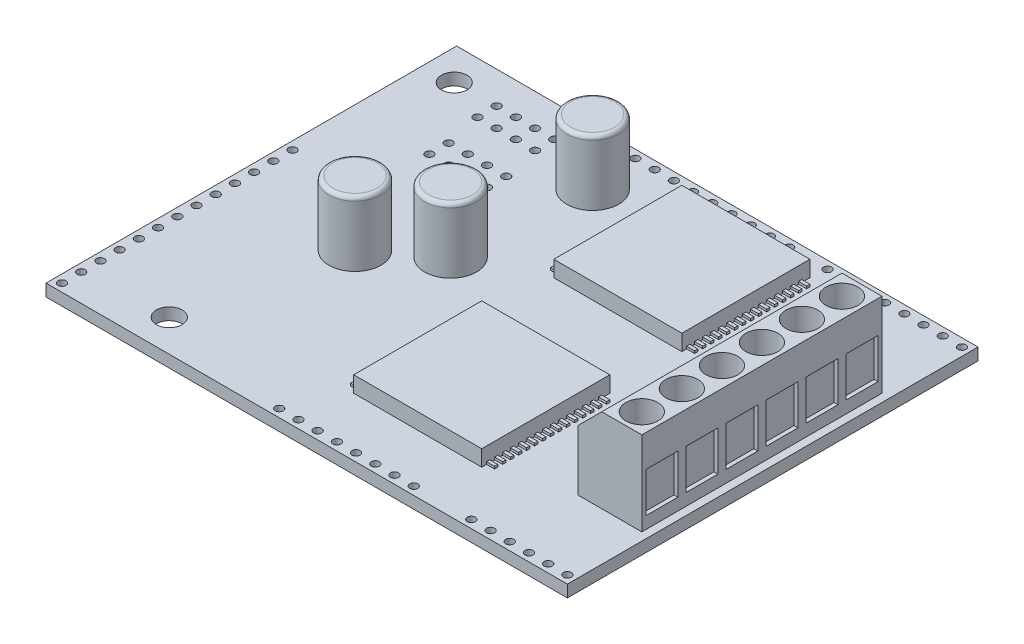
from build123d import *

# Parameters (mm, degrees)
SKETCH_1_W          = 65.14
SKETCH_1_H          = 51.3
EXTRUDE_1_DEPTH     = 1.5
SKETCH_2_W          = 16
SKETCH_2_H          = 16
EXTRUDE_2_DEPTH     = 2
SKETCH_3_W          = 1
SKETCH_3_H          = 0.4
EXTRUDE_3_DEPTH     = 0.3
SKETCH_4_R          = 0.5
SKETCH_4_R_2        = 1.6
CUT_EXTRUDE_1_DEPTH = 2
SKETCH_5_W          = 8
SKETCH_5_H          = 30
EXTRUDE_4_DEPTH     = 10.5
CHAMFER_1_SIZE      = 3
SKETCH_6_R          = 2
CUT_EXTRUDE_2_DEPTH = 4
SKETCH_7_W          = 4
SKETCH_7_H          = 5
CUT_EXTRUDE_3_DEPTH = 0.5
SKETCH_8_R          = 0.5
CUT_EXTRUDE_4_DEPTH = 0.2
SKETCH_9_R          = 3.25
EXTRUDE_5_DEPTH     = 8.1
FILLET_1_R          = 0.5


with BuildPart() as part:
    # Эскиз1 → Бобышка-Вытянуть1 (new body)
    with BuildSketch(Plane(origin=(0, 0, 0), x_dir=(1, 0, 0), z_dir=(0, 1, 0))):
        Rectangle(SKETCH_1_W, SKETCH_1_H)
    extrude(amount=EXTRUDE_1_DEPTH)

    # Эскиз2 → Бобышка-Вытянуть2 (add)
    with BuildSketch(Plane(origin=(0, 1.5, 0), x_dir=(1, 0, 0), z_dir=(0, 1, 0))):
        with Locations((6.57, 14.65)):
            Rectangle(SKETCH_2_W, SKETCH_2_H)
        with Locations((6.57, -10.35)):
            Rectangle(SKETCH_2_W, SKETCH_2_H)
    extrude(amount=EXTRUDE_2_DEPTH)

    # Эскиз3 → Бобышка-Вытянуть3 (add)
    with BuildSketch(Plane(origin=(0, 1.5, 0), x_dir=(1, 0, 0), z_dir=(0, 1, 0))):
        with Locations((15.07, 21.45)):
            Rectangle(SKETCH_3_W, SKETCH_3_H)
        with Locations((15.07, 20.45)):
            Rectangle(SKETCH_3_W, SKETCH_3_H)
        with Locations((15.07, 19.45)):
            Rectangle(SKETCH_3_W, SKETCH_3_H)
        with Locations((15.07, 18.45)):
            Rectangle(SKETCH_3_W, SKETCH_3_H)
        with Locations((15.07, 17.45)):
            Rectangle(SKETCH_3_W, SKETCH_3_H)
        with Locations((15.07, 16.45)):
            Rectangle(SKETCH_3_W, SKETCH_3_H)
        with Locations((15.07, 15.45)):
            Rectangle(SKETCH_3_W, SKETCH_3_H)
        with Locations((15.07, 14.45)):
            Rectangle(SKETCH_3_W, SKETCH_3_H)
        with Locations((15.07, 13.45)):
            Rectangle(SKETCH_3_W, SKETCH_3_H)
        with Locations((15.07, 12.45)):
            Rectangle(SKETCH_3_W, SKETCH_3_H)
        with Locations((15.07, 11.45)):
            Rectangle(SKETCH_3_W, SKETCH_3_H)
        with Locations((15.07, 10.45)):
            Rectangle(SKETCH_3_W, SKETCH_3_H)
        with Locations((15.07, 9.45)):
            Rectangle(SKETCH_3_W, SKETCH_3_H)
        with Locations((15.07, 8.45)):
            Rectangle(SKETCH_3_W, SKETCH_3_H)
        with Locations((15.07, 7.45)):
            Rectangle(SKETCH_3_W, SKETCH_3_H)
        with Locations((-1.93, 7.45)):
            Rectangle(SKETCH_3_W, SKETCH_3_H)
        with Locations((-1.93, 8.45)):
            Rectangle(SKETCH_3_W, SKETCH_3_H)
        with Locations((-1.93, 9.45)):
            Rectangle(SKETCH_3_W, SKETCH_3_H)
        with Locations((-1.93, 10.45)):
            Rectangle(SKETCH_3_W, SKETCH_3_H)
        with Locations((-1.93, 11.45)):
            Rectangle(SKETCH_3_W, SKETCH_3_H)
        with Locations((-1.93, 12.45)):
            Rectangle(SKETCH_3_W, SKETCH_3_H)
        with Locations((-1.93, 13.45)):
            Rectangle(SKETCH_3_W, SKETCH_3_H)
        with Locations((-1.93, 14.45)):
            Rectangle(SKETCH_3_W, SKETCH_3_H)
        with Locations((-1.93, 15.45)):
            Rectangle(SKETCH_3_W, SKETCH_3_H)
        with Locations((-1.93, 16.45)):
            Rectangle(SKETCH_3_W, SKETCH_3_H)
        with Locations((-1.93, 17.45)):
            Rectangle(SKETCH_3_W, SKETCH_3_H)
        with Locations((-1.93, 18.45)):
            Rectangle(SKETCH_3_W, SKETCH_3_H)
        with Locations((-1.93, 19.45)):
            Rectangle(SKETCH_3_W, SKETCH_3_H)
        with Locations((-1.93, 20.45)):
            Rectangle(SKETCH_3_W, SKETCH_3_H)
        with Locations((-1.93, 21.45)):
            Rectangle(SKETCH_3_W, SKETCH_3_H)
        with Locations((15.07, -3.55)):
            Rectangle(SKETCH_3_W, SKETCH_3_H)
        with Locations((15.07, -4.55)):
            Rectangle(SKETCH_3_W, SKETCH_3_H)
        with Locations((15.07, -5.55)):
            Rectangle(SKETCH_3_W, SKETCH_3_H)
        with Locations((15.07, -6.55)):
            Rectangle(SKETCH_3_W, SKETCH_3_H)
        with Locations((15.07, -7.55)):
            Rectangle(SKETCH_3_W, SKETCH_3_H)
        with Locations((15.07, -8.55)):
            Rectangle(SKETCH_3_W, SKETCH_3_H)
        with Locations((15.07, -9.55)):
            Rectangle(SKETCH_3_W, SKETCH_3_H)
        with Locations((15.07, -10.55)):
            Rectangle(SKETCH_3_W, SKETCH_3_H)
        with Locations((15.07, -11.55)):
            Rectangle(SKETCH_3_W, SKETCH_3_H)
        with Locations((15.07, -12.55)):
            Rectangle(SKETCH_3_W, SKETCH_3_H)
        with Locations((15.07, -13.55)):
            Rectangle(SKETCH_3_W, SKETCH_3_H)
        with Locations((15.07, -14.55)):
            Rectangle(SKETCH_3_W, SKETCH_3_H)
        with Locations((15.07, -15.55)):
            Rectangle(SKETCH_3_W, SKETCH_3_H)
        with Locations((15.07, -16.55)):
            Rectangle(SKETCH_3_W, SKETCH_3_H)
        with Locations((15.07, -17.55)):
            Rectangle(SKETCH_3_W, SKETCH_3_H)
        with Locations((-1.93, -17.55)):
            Rectangle(SKETCH_3_W, SKETCH_3_H)
        with Locations((-1.93, -16.55)):
            Rectangle(SKETCH_3_W, SKETCH_3_H)
        with Locations((-1.93, -15.55)):
            Rectangle(SKETCH_3_W, SKETCH_3_H)
        with Locations((-1.93, -14.55)):
            Rectangle(SKETCH_3_W, SKETCH_3_H)
        with Locations((-1.93, -13.55)):
            Rectangle(SKETCH_3_W, SKETCH_3_H)
        with Locations((-1.93, -12.55)):
            Rectangle(SKETCH_3_W, SKETCH_3_H)
        with Locations((-1.93, -11.55)):
            Rectangle(SKETCH_3_W, SKETCH_3_H)
        with Locations((-1.93, -10.55)):
            Rectangle(SKETCH_3_W, SKETCH_3_H)
        with Locations((-1.93, -9.55)):
            Rectangle(SKETCH_3_W, SKETCH_3_H)
        with Locations((-1.93, -8.55)):
            Rectangle(SKETCH_3_W, SKETCH_3_H)
        with Locations((-1.93, -7.55)):
            Rectangle(SKETCH_3_W, SKETCH_3_H)
        with Locations((-1.93, -6.55)):
            Rectangle(SKETCH_3_W, SKETCH_3_H)
        with Locations((-1.93, -5.55)):
            Rectangle(SKETCH_3_W, SKETCH_3_H)
        with Locations((-1.93, -4.55)):
            Rectangle(SKETCH_3_W, SKETCH_3_H)
        with Locations((-1.93, -3.55)):
            Rectangle(SKETCH_3_W, SKETCH_3_H)
    extrude(amount=EXTRUDE_3_DEPTH)

    # Эскиз4 → Вырез-Вытянуть1 (cut)
    with BuildSketch(Plane(origin=(0, 1.5, 0), x_dir=(1, 0, 0), z_dir=(0, 1, 0))):
        with Locations((31.57, -24.65)):
            Circle(SKETCH_4_R)
        with Locations((29.17, -24.65)):
            Circle(SKETCH_4_R)
        with Locations((26.77, -24.65)):
            Circle(SKETCH_4_R)
        with Locations((24.37, -24.65)):
            Circle(SKETCH_4_R)
        with Locations((21.97, -24.65)):
            Circle(SKETCH_4_R)
        with Locations((19.57, -24.65)):
            Circle(SKETCH_4_R)
        with Locations((31.57, 24.65)):
            Circle(SKETCH_4_R)
        with Locations((29.17, 24.65)):
            Circle(SKETCH_4_R)
        with Locations((12.37, -24.65)):
            Circle(SKETCH_4_R)
        with Locations((9.97, -24.65)):
            Circle(SKETCH_4_R)
        with Locations((7.57, -24.65)):
            Circle(SKETCH_4_R)
        with Locations((5.17, -24.65)):
            Circle(SKETCH_4_R)
        with Locations((2.77, -24.65)):
            Circle(SKETCH_4_R)
        with Locations((0.37, -24.65)):
            Circle(SKETCH_4_R)
        with Locations((-2.03, -24.65)):
            Circle(SKETCH_4_R)
        with Locations((-4.43, -24.65)):
            Circle(SKETCH_4_R)
        with Locations((26.77, 24.65)):
            Circle(SKETCH_4_R)
        with Locations((24.37, 24.65)):
            Circle(SKETCH_4_R)
        with Locations((21.97, 24.65)):
            Circle(SKETCH_4_R)
        with Locations((19.57, 24.65)):
            Circle(SKETCH_4_R)
        with Locations((17.17, 24.65)):
            Circle(SKETCH_4_R)
        with Locations((14.77, 24.65)):
            Circle(SKETCH_4_R)
        with Locations((-31.57, -24.65)):
            Circle(SKETCH_4_R)
        with Locations((9.97, 24.65)):
            Circle(SKETCH_4_R)
        with Locations((7.57, 24.65)):
            Circle(SKETCH_4_R)
        with Locations((5.17, 24.65)):
            Circle(SKETCH_4_R)
        with Locations((2.77, 24.65)):
            Circle(SKETCH_4_R)
        with Locations((0.37, 24.65)):
            Circle(SKETCH_4_R)
        with Locations((-2.03, 24.65)):
            Circle(SKETCH_4_R)
        with Locations((-4.43, 24.65)):
            Circle(SKETCH_4_R)
        with Locations((-6.83, 24.65)):
            Circle(SKETCH_4_R)
        with Locations((-9.23, 24.65)):
            Circle(SKETCH_4_R)
        with Locations((-11.63, 24.65)):
            Circle(SKETCH_4_R)
        with Locations((-31.57, -22.25)):
            Circle(SKETCH_4_R)
        with Locations((-31.57, -19.85)):
            Circle(SKETCH_4_R)
        with Locations((-31.57, -17.45)):
            Circle(SKETCH_4_R)
        with Locations((-31.57, -15.05)):
            Circle(SKETCH_4_R)
        with Locations((-31.57, -12.65)):
            Circle(SKETCH_4_R)
        with Locations((-31.57, -10.25)):
            Circle(SKETCH_4_R)
        with Locations((-31.57, -7.85)):
            Circle(SKETCH_4_R)
        with Locations((-31.57, -5.45)):
            Circle(SKETCH_4_R)
        with Locations((-31.57, -3.05)):
            Circle(SKETCH_4_R)
        with Locations((-31.57, -0.65)):
            Circle(SKETCH_4_R)
        with Locations((-31.57, 1.75)):
            Circle(SKETCH_4_R)
        with Locations((-31.57, 4.15)):
            Circle(SKETCH_4_R)
        with Locations((-28.77, 21.55)):
            Circle(SKETCH_4_R_2)
        with Locations((-21.17, -21.65)):
            Circle(SKETCH_4_R_2)
        with Locations((-23.57, 21.65)):
            Circle(SKETCH_4_R)
        with Locations((-21.17, 21.65)):
            Circle(SKETCH_4_R)
        with Locations((-18.77, 21.65)):
            Circle(SKETCH_4_R)
        with Locations((-16.37, 21.65)):
            Circle(SKETCH_4_R)
        with Locations((-21.17, 19.25)):
            Circle(SKETCH_4_R)
        with Locations((-18.77, 19.25)):
            Circle(SKETCH_4_R)
        with Locations((-16.37, 19.25)):
            Circle(SKETCH_4_R)
        with Locations((-23.57, 19.25)):
            Circle(SKETCH_4_R)
        with Locations((-22.57, 14.65)):
            Circle(SKETCH_4_R)
        with Locations((-20.17, 14.65)):
            Circle(SKETCH_4_R)
        with Locations((-17.77, 14.65)):
            Circle(SKETCH_4_R)
        with Locations((-15.37, 14.65)):
            Circle(SKETCH_4_R)
        with Locations((-20.17, 12.25)):
            Circle(SKETCH_4_R)
        with Locations((-17.77, 12.25)):
            Circle(SKETCH_4_R)
        with Locations((-15.37, 12.25)):
            Circle(SKETCH_4_R)
        with Locations((-22.57, 12.25)):
            Circle(SKETCH_4_R)
    extrude(amount=-CUT_EXTRUDE_1_DEPTH, mode=Mode.SUBTRACT)

    # Эскиз5 → Бобышка-Вытянуть4 (add)
    with BuildSketch(Plane(origin=(0, 1.5, 0), x_dir=(1, 0, 0), z_dir=(0, 1, 0))):
        with Locations((27.57, -0.35)):
            Rectangle(SKETCH_5_W, SKETCH_5_H)
    extrude(amount=EXTRUDE_4_DEPTH)

    # Фаска1
    chamfer_1_edges = [part.edges().sort_by_distance(p)[0] for p in [
        (23.57, 12, 0.35),
    ]]
    chamfer(chamfer_1_edges, length=CHAMFER_1_SIZE)

    # Эскиз6 → Вырез-Вытянуть2 (cut)
    with BuildSketch(Plane(origin=(0, 12, 0), x_dir=(1, 0, 0), z_dir=(0, 1, 0))):
        with Locations((29.069276904, 12.15)):
            Circle(SKETCH_6_R)
        with Locations((29.069276904, 7.15)):
            Circle(SKETCH_6_R)
        with Locations((29.069276904, 2.15)):
            Circle(SKETCH_6_R)
        with Locations((29.069276904, -2.85)):
            Circle(SKETCH_6_R)
        with Locations((29.069276904, -7.85)):
            Circle(SKETCH_6_R)
        with Locations((29.069276904, -12.85)):
            Circle(SKETCH_6_R)
    extrude(amount=-CUT_EXTRUDE_2_DEPTH, mode=Mode.SUBTRACT)

    # Эскиз7 → Вырез-Вытянуть3 (cut)
    with BuildSketch(Plane(origin=(31.57, 0, 0), x_dir=(0, 0, -1), z_dir=(1, 0, 0))):
        with Locations((12.15, 5.5)):
            Rectangle(SKETCH_7_W, SKETCH_7_H)
        with Locations((7.15, 5.5)):
            Rectangle(SKETCH_7_W, SKETCH_7_H)
        with Locations((2.15, 5.5)):
            Rectangle(SKETCH_7_W, SKETCH_7_H)
        with Locations((-2.85, 5.5)):
            Rectangle(SKETCH_7_W, SKETCH_7_H)
        with Locations((-7.85, 5.5)):
            Rectangle(SKETCH_7_W, SKETCH_7_H)
        with Locations((-12.85, 5.5)):
            Rectangle(SKETCH_7_W, SKETCH_7_H)
    extrude(amount=-CUT_EXTRUDE_3_DEPTH, mode=Mode.SUBTRACT)

    # Эскиз8 → Вырез-Вытянуть4 (cut)
    with BuildSketch(Plane(origin=(7.285, -7.285, 0), x_dir=(0, 0, 1), z_dir=(-0.7071067811865495, 0.7071067811865457, 0))):
        with Locations((-12.15, 25.030467863)):
            Circle(SKETCH_8_R)
        with Locations((-7.15, 25.030467863)):
            Circle(SKETCH_8_R)
        with Locations((-2.15, 25.030467863)):
            Circle(SKETCH_8_R)
        with Locations((2.85, 25.030467863)):
            Circle(SKETCH_8_R)
        with Locations((7.85, 25.030467863)):
            Circle(SKETCH_8_R)
        with Locations((12.85, 25.030467863)):
            Circle(SKETCH_8_R)
    extrude(amount=-CUT_EXTRUDE_4_DEPTH, mode=Mode.SUBTRACT)

    # Эскиз9 → Бобышка-Вытянуть5 (add)
    with BuildSketch(Plane(origin=(0, 1.5, 0), x_dir=(1, 0, 0), z_dir=(0, 1, 0))):
        with Locations((-8.57, 18.65)):
            Circle(SKETCH_9_R)
        with Locations((-16.82, -2.8)):
            Circle(SKETCH_9_R)
        with Locations((-10.12, 2.45)):
            Circle(SKETCH_9_R)
    extrude(amount=EXTRUDE_5_DEPTH)

    # Скругление1
    fillet_1_edges = [part.edges().sort_by_distance(p)[0] for p in [
        (-20.07, 9.6, 2.8),
        (-13.37, 9.6, -2.45),
        (-11.82, 9.6, -18.65),
    ]]
    fillet(fillet_1_edges, radius=FILLET_1_R)


solid = part.part
